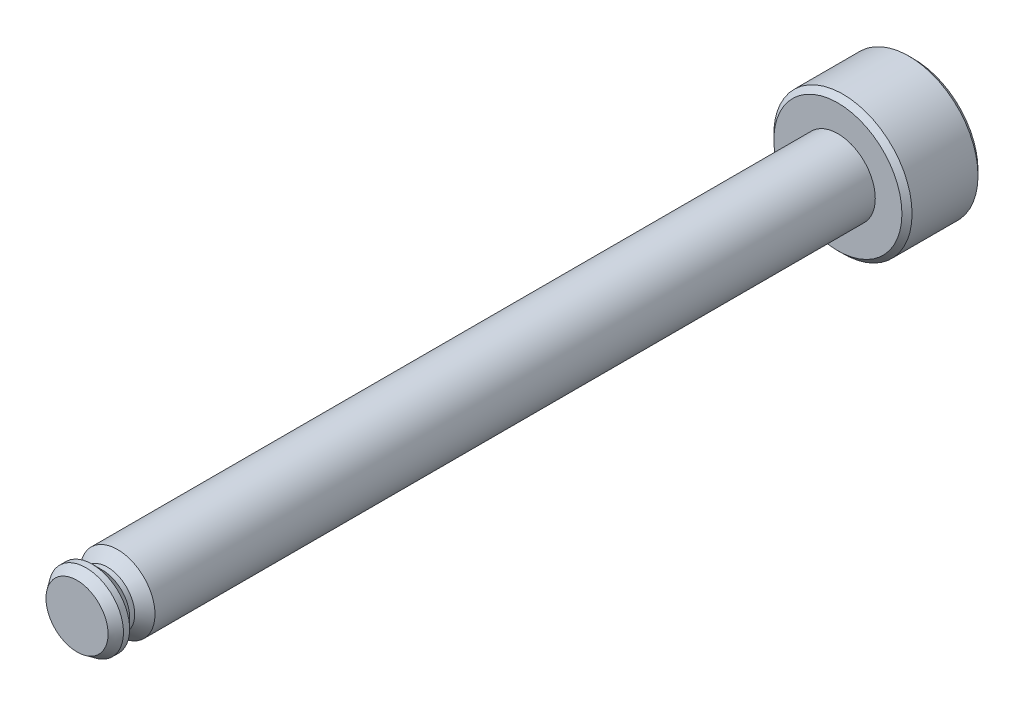
from build123d import *

# Parameters (mm, degrees)
SKETCH2_R      = 1.475
SHAFT_DEPTH    = 30
SKETCH5_R      = 2.725
HEAD_DEPTH     = 3
CHAMFER1_SIZE  = 0.25
CHAMFER1_SIZE2 = 0.357037002
DEBURS_SIZE    = 0.2


with BuildPart() as part:
    # Sketch2 → Shaft (new body)
    with BuildSketch(Plane.XY):
        Circle(SKETCH2_R)
    extrude(amount=SHAFT_DEPTH)

    # Sketch5 → Head (add)
    with BuildSketch(Plane.XY):
        Circle(SKETCH5_R)
    extrude(amount=-HEAD_DEPTH)

    # Chamfer1
    chamfer1_edges = [part.edges().sort_by_distance(p)[0] for p in [
        (-1.475, 0, 30),
    ]]
    chamfer1_side = [part.faces().sort_by_distance(p)[0] for p in [
        (0, 0, 30),
    ]]
    chamfer(chamfer1_edges, length=CHAMFER1_SIZE, length2=CHAMFER1_SIZE2, reference=chamfer1_side[0])

    # Deburs
    deburs_edges = [part.edges().sort_by_distance(p)[0] for p in [
        (-2.725, 0, 0),
        (-2.725, 0, -3),
    ]]
    chamfer(deburs_edges, length=DEBURS_SIZE)

    # Sketch6 → e-Clip Notch Long (revolve, cut)
    with BuildSketch(Plane(origin=(0, 0, 0), x_dir=(0, 0, -1), z_dir=(1, 0, 0))):
        Polygon((-29.4, 1.475), (-28.4, 1.475), (-28.8, 1.075), (-29, 1.075), align=None)
    revolve(axis=Axis((0, 0, 0), (0, 0, 1)), mode=Mode.SUBTRACT)


solid = part.part
